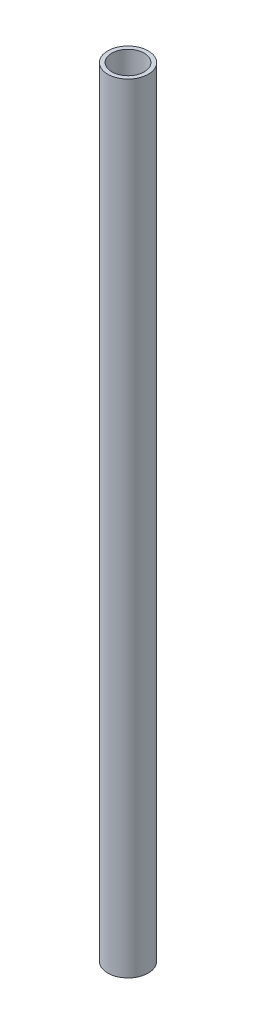
from build123d import *

# Parameters (mm, degrees)
SKETCH1_R             = 15.875
SKETCH1_R_2           = 12.7
SHAFT_EXTRUSION_DEPTH = 609.6


with BuildPart() as part:
    # Sketch1 → Shaft extrusion (new body)
    with BuildSketch(Plane(origin=(0, 0, 0), x_dir=(1, 0, 0), z_dir=(0, 1, 0))):
        Circle(SKETCH1_R)
        Circle(SKETCH1_R_2, mode=Mode.SUBTRACT)
    extrude(amount=SHAFT_EXTRUSION_DEPTH)


solid = part.part
